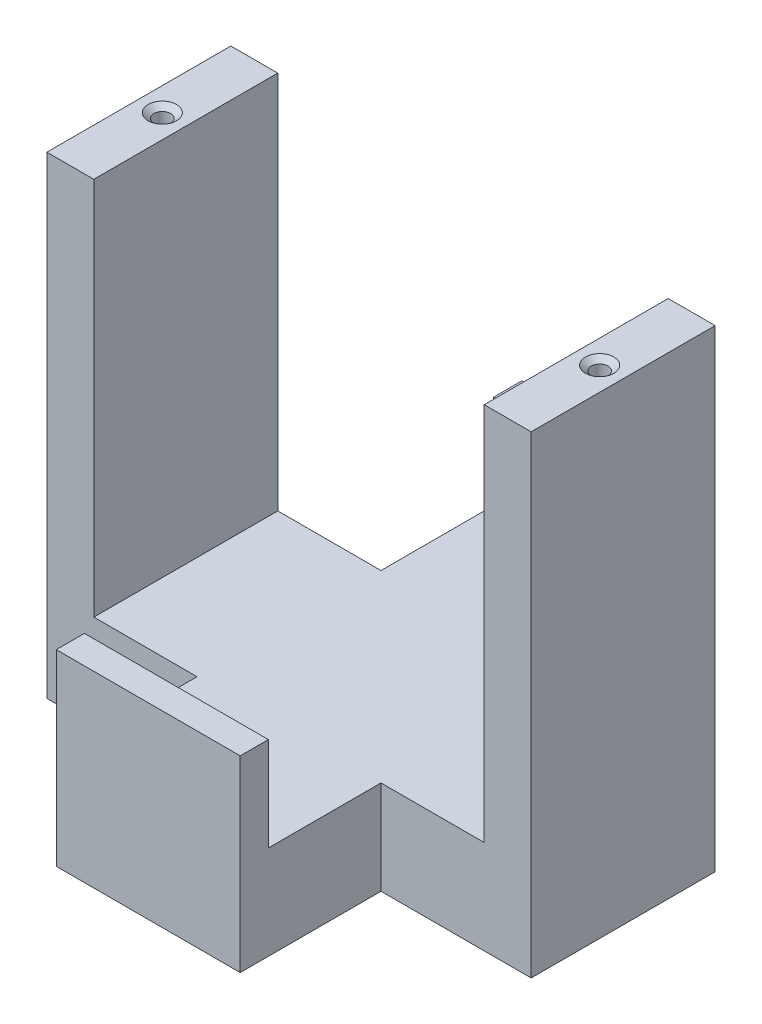
from build123d import *

# Parameters (mm, degrees)
RESSALTO_EXTRUS_O1_DEPTH                             = 10
ESBO_O2_W                                            = 5
ESBO_O2_H                                            = 19.6
RESSALTO_EXTRUS_O2_DEPTH                             = 50.4
RESSALTO_EXTRUS_O3_DEPTH                             = 10
RESSALTO_EXTRUS_O3_DEPTH_BACK                        = 10
ESBO_O3_W                                            = 19.6
ESBO_O3_H                                            = 3
ESCAREADO_PARA_PARAFUSO_DE_M_QUINA_COM_C_D           = 1.778
ESCAREADO_PARA_PARAFUSO_DE_M_QUINA_COM_C_DEPTH       = 5
ESCAREADO_PARA_PARAFUSO_DE_M_QUINA_COM_C_CSINK_D     = 3.0226
ESCAREADO_PARA_PARAFUSO_DE_M_QUINA_COM_C_CSINK_ANGLE = 100
ESCAREADO_PARA_PARAFUSO_DE_M_QUINA_COM_C_TIP         = 0.53416509
ESCAREADO_PARA_PARAFUSO_DE_M_QUINA_C_2_D             = 1.778
ESCAREADO_PARA_PARAFUSO_DE_M_QUINA_C_2_DEPTH         = 5
ESCAREADO_PARA_PARAFUSO_DE_M_QUINA_C_2_CSINK_D       = 3.0226
ESCAREADO_PARA_PARAFUSO_DE_M_QUINA_C_2_CSINK_ANGLE   = 100
ESCAREADO_PARA_PARAFUSO_DE_M_QUINA_C_2_TIP           = 0.53416509


with BuildPart() as part:
    # Esboço1 → Ressalto-extrusão1 (new body)
    with BuildSketch(Plane(origin=(0, 0, 0), x_dir=(1, 0, 0), z_dir=(0, 1, 0))):
        Polygon((-9.8, 21.8), (-9.8, 9.8), (-20.8, 9.8), (-20.8, -9.8), (-9.8, -9.8), (-9.8, -21.8), (9.8, -21.8), (9.8, -9.8), (20.8, -9.8), (20.8, 9.8), (9.8, 9.8), (9.8, 21.8), align=None)
    extrude(amount=RESSALTO_EXTRUS_O1_DEPTH)

    # Esboço2 → Ressalto-extrusão2 (add)
    with BuildSketch(Plane(origin=(0, 0, 0), x_dir=(1, 0, 0), z_dir=(0, 1, 0))):
        with Locations((23.3, 0)):
            Rectangle(ESBO_O2_W, ESBO_O2_H)
        with Locations((-23.3, 0)):
            Rectangle(ESBO_O2_W, ESBO_O2_H)
    extrude(amount=RESSALTO_EXTRUS_O2_DEPTH)

    # Esboço3 → Ressalto-extrusão3 (add, two sides: drawn at the far end of the back side and taken through both)
    with BuildSketch(Plane(origin=(0, 10, 0), x_dir=(1, 0, 0), z_dir=(0, 1, 0)).offset(-RESSALTO_EXTRUS_O3_DEPTH_BACK)):
        with Locations((0, 23.3)):
            Rectangle(ESBO_O3_W, ESBO_O3_H)
        with Locations((0, -23.3)):
            Rectangle(ESBO_O3_W, ESBO_O3_H)
    extrude(amount=RESSALTO_EXTRUS_O3_DEPTH + RESSALTO_EXTRUS_O3_DEPTH_BACK)

    # Escareado para parafuso de m_quina com c
    with Locations(Plane(origin=(0, 50.4, 0), x_dir=(1, 0, 0), z_dir=(0, 1, 0))):
        with Locations((-23.3, 0), (23.3, 0)):
            CounterSinkHole(ESCAREADO_PARA_PARAFUSO_DE_M_QUINA_COM_C_D / 2, ESCAREADO_PARA_PARAFUSO_DE_M_QUINA_COM_C_CSINK_D / 2, depth=ESCAREADO_PARA_PARAFUSO_DE_M_QUINA_COM_C_DEPTH, counter_sink_angle=ESCAREADO_PARA_PARAFUSO_DE_M_QUINA_COM_C_CSINK_ANGLE)
            with Locations((0, 0, -(ESCAREADO_PARA_PARAFUSO_DE_M_QUINA_COM_C_DEPTH + ESCAREADO_PARA_PARAFUSO_DE_M_QUINA_COM_C_TIP / 2))):  # 118° drill point
                Cone(0, ESCAREADO_PARA_PARAFUSO_DE_M_QUINA_COM_C_D / 2, ESCAREADO_PARA_PARAFUSO_DE_M_QUINA_COM_C_TIP, mode=Mode.SUBTRACT)

    # Escareado para parafuso de m_quina c 2
    with Locations(Plane(origin=(0, 0, 0), x_dir=(-1, 0, 0), z_dir=(0, -1, 0))):
        with Locations((-17.8, 0), (17.8, 0)):
            CounterSinkHole(ESCAREADO_PARA_PARAFUSO_DE_M_QUINA_C_2_D / 2, ESCAREADO_PARA_PARAFUSO_DE_M_QUINA_C_2_CSINK_D / 2, depth=ESCAREADO_PARA_PARAFUSO_DE_M_QUINA_C_2_DEPTH, counter_sink_angle=ESCAREADO_PARA_PARAFUSO_DE_M_QUINA_C_2_CSINK_ANGLE)
            with Locations((0, 0, -(ESCAREADO_PARA_PARAFUSO_DE_M_QUINA_C_2_DEPTH + ESCAREADO_PARA_PARAFUSO_DE_M_QUINA_C_2_TIP / 2))):  # 118° drill point
                Cone(0, ESCAREADO_PARA_PARAFUSO_DE_M_QUINA_C_2_D / 2, ESCAREADO_PARA_PARAFUSO_DE_M_QUINA_C_2_TIP, mode=Mode.SUBTRACT)


solid = part.part
